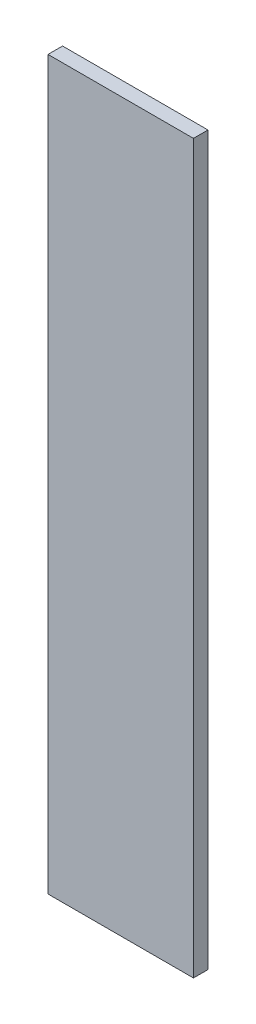
from build123d import *

# Parameters (mm, degrees)
SKETCH1_W           = 20
SKETCH1_H           = 100
BOSS_EXTRUDE1_DEPTH = 2


with BuildPart() as part:
    # Sketch1 → Boss-Extrude1 (new body)
    with BuildSketch(Plane.XY):
        Rectangle(SKETCH1_W, SKETCH1_H)
    extrude(amount=BOSS_EXTRUDE1_DEPTH)


solid = part.part
